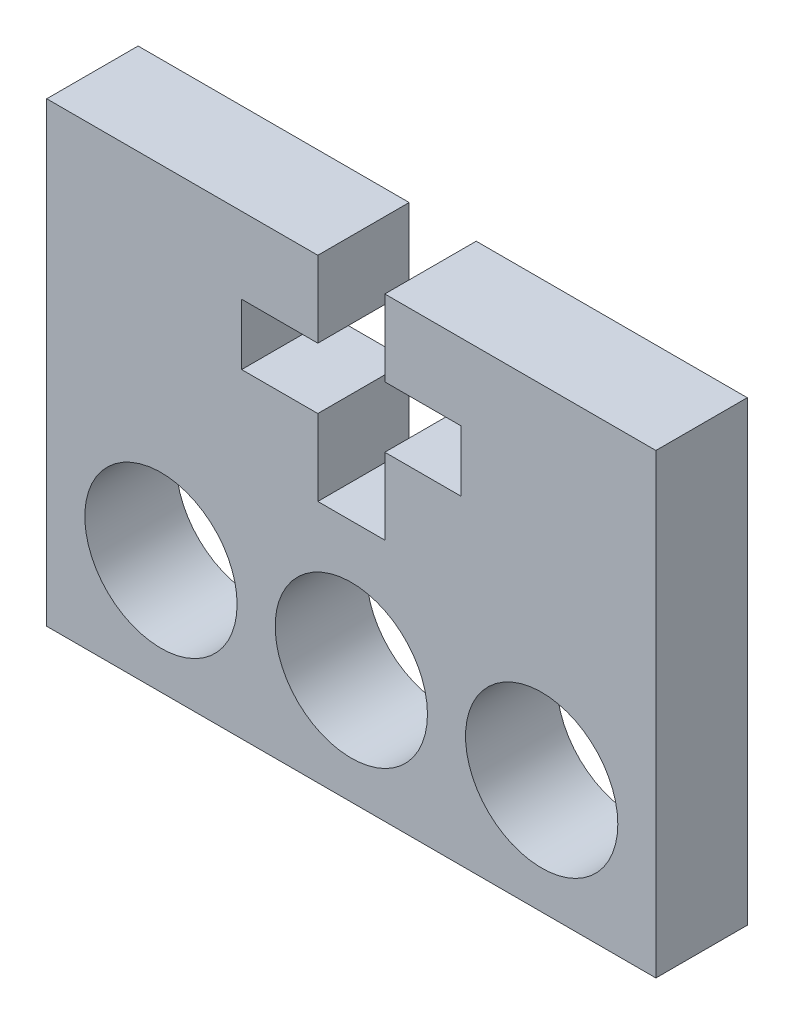
from build123d import *

# Parameters (mm, degrees)
SKETCH1_R           = 2.5
BOSS_EXTRUDE1_DEPTH = 3


with BuildPart() as part:
    # Sketch1 → Boss-Extrude1 (new body)
    with BuildSketch(Plane.XY):
        Polygon((-10, 7.5), (-10, -7.5), (10, -7.5), (10, 7.5), (1.1, 7.5), (1.1, 5), (3.6, 5), (3.6, 3), (1.1, 3), (1.1, 0.5), (-1.1, 0.5), (-1.1, 3), (-3.6, 3), (-3.6, 5), (-1.1, 5), (-1.1, 7.5), align=None)
        with Locations((-6.25, -3.75)):
            Circle(SKETCH1_R, mode=Mode.SUBTRACT)
        with Locations((0, -3.75)):
            Circle(SKETCH1_R, mode=Mode.SUBTRACT)
        with Locations((6.25, -3.75)):
            Circle(SKETCH1_R, mode=Mode.SUBTRACT)
    extrude(amount=BOSS_EXTRUDE1_DEPTH)


solid = part.part
